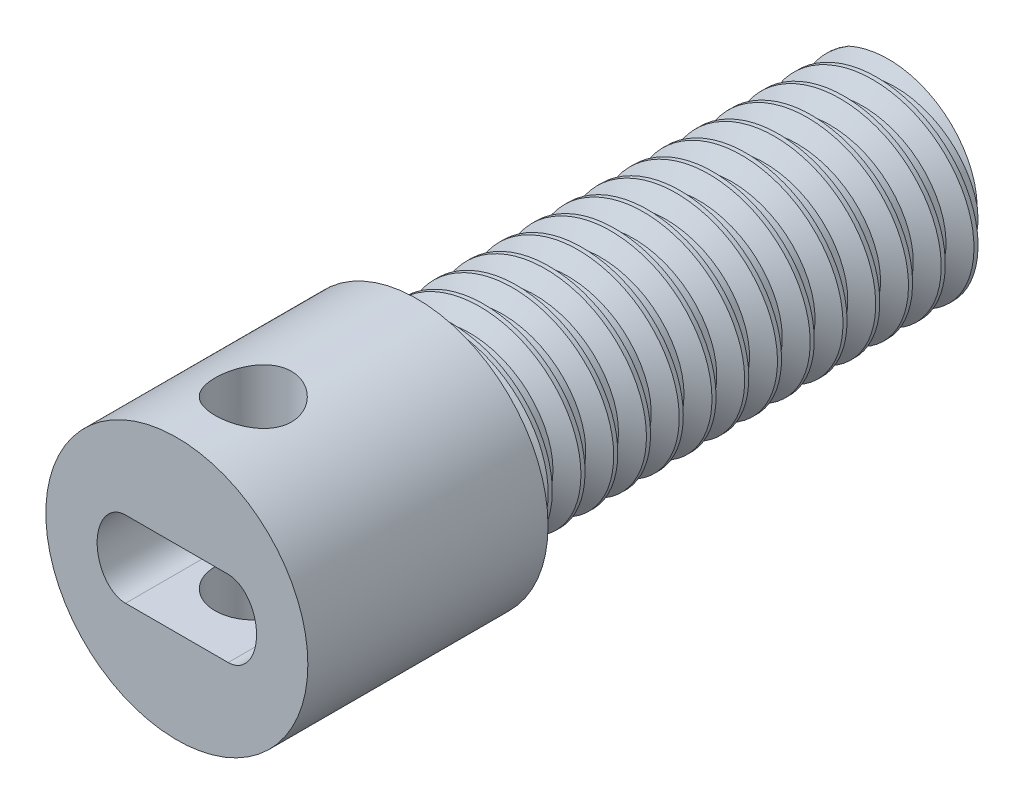
from build123d import *

# Parameters (mm, degrees)
SKETCH1_R               = 6
BOSS_EXTRUDE1_DEPTH     = 11
SKETCH2_R               = 4.5
BOSS_EXTRUDE2_DEPTH     = 24
THREAD2_PITCH           = 1.5
THREAD2_TO              = 24
SKETCH10_R              = 5
CUT_EXTRUDE1_DEPTH      = 2
CUT_EXTRUDE2_DEPTH      = 7
CUT_EXTRUDE4_DEPTH      = 25.084486857
CUT_EXTRUDE4_DEPTH_BACK = 25.084486857
SKETCH13_R              = 1.75


with BuildPart() as part:
    # Sketch1 → Boss-Extrude1 (new body)
    with BuildSketch(Plane.XY):
        Circle(SKETCH1_R)
    extrude(amount=BOSS_EXTRUDE1_DEPTH)

    # Sketch2 → Boss-Extrude2 (add)
    with BuildSketch(Plane(origin=(0, 0, 0), x_dir=(-1, 0, 0), z_dir=(0, 0, -1))):
        Circle(SKETCH2_R)
    extrude(amount=BOSS_EXTRUDE2_DEPTH)

    # Thread2: arcs per turn and ends read off the stored shape
    # Thread2: the profile of Thread Profile3 profile screwed along a right-hand helix through 16 turns, 8 arcs to a turn; built about Z, then put on its axis
    thread2_z = Axis((0, 0, 0), (0, 0, 1))
    thread2_corners = [(4.5003, 0, -0.000173205), (4.5003, 0, 1.312673201), (3.688101188, 0, 0.843749998), (3.688101188, 0, 0.468749998)]
    with BuildLine(mode=Mode.PRIVATE) as thread2_profile:
        Line(thread2_corners[0], thread2_corners[1])
        Line(thread2_corners[1], thread2_corners[2])
        Line(thread2_corners[2], thread2_corners[3])
        Line(thread2_corners[3], thread2_corners[0])
    thread2_cap = Face(thread2_profile.wire())
    thread2_turn_angles = [0, 22.5, 45, 67.5, 90, 112.5, 135, 157.5, 180, 202.5, 225, 247.5, 270, 292.5, 315, 337.5, 360]
    thread2_turn_weights = [1, 0.9238795325112867, 1, 0.9238795325112867, 1, 0.9238795325112867, 1, 0.9238795325112867, 1, 0.9238795325112867, 1, 0.9238795325112867, 1, 0.9238795325112867, 1, 0.9238795325112867, 1]
    thread2_turn_rails = [Edge.make_bspline([Vector(p[0], p[1], 0).rotate(thread2_z, thread2_turn_angles[k]) / thread2_turn_weights[k] + Vector(0, 0, p[2] + THREAD2_PITCH * thread2_turn_angles[k] / 360) for k in range(17)], [0, 0, 0, 1, 1, 2, 2, 3, 3, 4, 4, 5, 5, 6, 6, 7, 7, 8, 8, 8], 2, thread2_turn_weights) for p in thread2_corners]
    thread2_turn_sides = [Face.make_surface_from_curves(thread2_turn_rails[p[0]], thread2_turn_rails[p[1]]) for p in [(0, 1), (1, 2), (2, 3), (3, 0)]]
    thread2 = Plane(origin=(0, 0, -24), x_dir=(1, 0, 0), z_dir=(0, 0, 1)) * split(Solid(Shell([*[p.moved(Location((0, 0, THREAD2_PITCH * i))) for i in range(16) for p in thread2_turn_sides], thread2_cap, thread2_cap.rotate(thread2_z, 5760).moved(Location((0, 0, THREAD2_PITCH * 5760 / 360)))])), bisect_by=Plane.XY.offset(THREAD2_TO), keep=Keep.BOTTOM, mode=Mode.PRIVATE)
    add(thread2, mode=Mode.SUBTRACT)

    # Sketch10 → Cut-Extrude1 (cut)
    with BuildSketch(Plane(origin=(0, 0, -24), x_dir=(-1, 0, 0), z_dir=(0, 0, -1))):
        Circle(SKETCH10_R)
    extrude(amount=-CUT_EXTRUDE1_DEPTH, mode=Mode.SUBTRACT)

    # Sketch11 → Cut-Extrude2 (cut)
    with BuildSketch(Plane.XY.offset(11)):
        with BuildLine():
            add(Edge.make_bspline(
                [(-2.35, -1.75), (-1.05, -1.75), (-1.05, 0), (-1.05, 1.75), (-2.35, 1.75)],
                knots=[3.141592654, 3.141592654, 3.141592654, 4.71238898, 4.71238898, 6.283185307, 6.283185307, 6.283185307], degree=2, weights=[1, 0.707106781, 1, 0.707106781, 1]))
            Line((-2.35, 1.75), (-2.35, -1.75))
        make_face()
        with BuildLine():
            Line((-2.35, -1.75), (-2.35, 1.75))
            add(Edge.make_bspline(
                [(-2.35, 1.75), (-3.65, 1.75), (-3.65, 0), (-3.65, -1.75), (-2.35, -1.75)],
                knots=[0, 0, 0, 1.570796327, 1.570796327, 3.141592654, 3.141592654, 3.141592654], degree=2, weights=[1, 0.707106781, 1, 0.707106781, 1]))
        make_face()
        with BuildLine():
            add(Edge.make_bspline(
                [(2.35, 1.75), (1.05, 1.75), (1.05, 0), (1.05, -1.75), (2.35, -1.75)],
                knots=[0, 0, 0, 1.570796327, 1.570796327, 3.141592654, 3.141592654, 3.141592654], degree=2, weights=[1, 0.707106781, 1, 0.707106781, 1]))
            Line((2.35, 1.75), (-2.35, 1.75))
            add(Edge.make_bspline(
                [(-2.35, -1.75), (-1.05, -1.75), (-1.05, 0), (-1.05, 1.75), (-2.35, 1.75)],
                knots=[3.141592654, 3.141592654, 3.141592654, 4.71238898, 4.71238898, 6.283185307, 6.283185307, 6.283185307], degree=2, weights=[1, 0.707106781, 1, 0.707106781, 1]))
            Line((-2.35, -1.75), (2.35, -1.75))
        make_face()
        with BuildLine():
            add(Edge.make_bspline(
                [(2.35, -1.75), (3.65, -1.75), (3.65, 0), (3.65, 1.75), (2.35, 1.75)],
                knots=[3.141592654, 3.141592654, 3.141592654, 4.71238898, 4.71238898, 6.283185307, 6.283185307, 6.283185307], degree=2, weights=[1, 0.707106781, 1, 0.707106781, 1]))
            Line((2.35, 1.75), (2.35, -1.75))
        make_face()
        with BuildLine():
            Line((2.35, -1.75), (2.35, 1.75))
            add(Edge.make_bspline(
                [(2.35, 1.75), (1.05, 1.75), (1.05, 0), (1.05, -1.75), (2.35, -1.75)],
                knots=[0, 0, 0, 1.570796327, 1.570796327, 3.141592654, 3.141592654, 3.141592654], degree=2, weights=[1, 0.707106781, 1, 0.707106781, 1]))
        make_face()
    extrude(amount=-CUT_EXTRUDE2_DEPTH, mode=Mode.SUBTRACT)

    # Sketch13 → Cut-Extrude4 (cut, two sides: drawn at the far end of the back side and taken through both)
    with BuildSketch(Plane.XZ.offset(-1.75).offset(-CUT_EXTRUDE4_DEPTH_BACK)):
        with Locations(Location((0, 7.5, 0), (0, 0, 270))):
            Circle(SKETCH13_R)
    extrude(amount=CUT_EXTRUDE4_DEPTH + CUT_EXTRUDE4_DEPTH_BACK, mode=Mode.SUBTRACT)


solid = part.part
